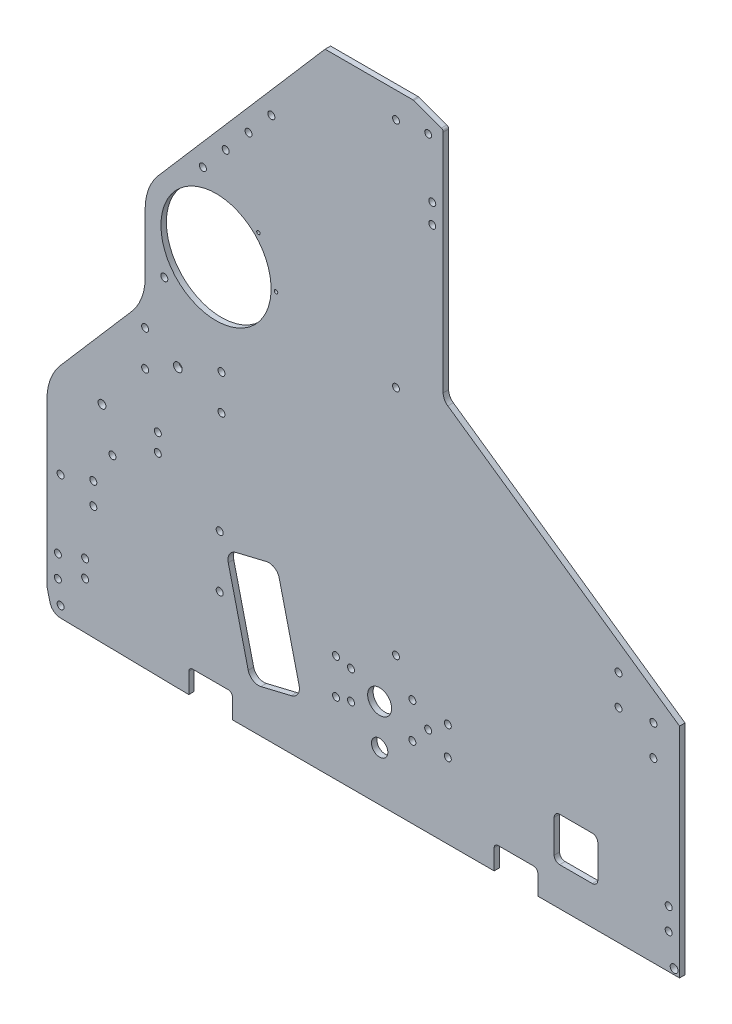
from build123d import *

# Parameters (mm, degrees)
SKETCH1_R           = 2.032
SKETCH1_R_2         = 2.54
SKETCH1_R_3         = 2
BOSS_EXTRUDE1_DEPTH = 3.175
FILLET1_R           = 2.286
FILLET2_R           = 6.35
SKETCH2_R           = 2.032
CUT_EXTRUDE1_DEPTH  = 505.524983177
FILLET3_R           = 1.5875
SKETCH3_R           = 2.032
SKETCH3_R_2         = 2.286
SKETCH3_R_3         = 1.016
CUT_EXTRUDE2_DEPTH  = 505.524983177
SKETCH4_R           = 2.032
SKETCH4_R_2         = 6.985
SKETCH4_R_3         = 4.7625
CUT_EXTRUDE3_DEPTH  = 505.524983177
SKETCH5_R           = 32.0675
SKETCH5_R_2         = 2.286
CUT_EXTRUDE5_DEPTH  = 540.282512071
FILLET4_R           = 31.75
CUT_EXTRUDE6_DEPTH  = 505.524983177


with BuildPart() as part:
    # Sketch1 → Boss-Extrude1 (new body)
    with BuildSketch(Plane.XY):
        with BuildLine():
            Line((7.829508682, -19.049081656), (82.55, -20.32))
            Line((82.55, -20.32), (82.55, -6.35))
            Line((82.55, -6.35), (107.95, -6.35))
            Line((107.95, -6.35), (107.95, -20.32))
            Line((107.95, -20.32), (260.35, -20.32))
            Line((260.35, -20.32), (260.35, -6.35))
            Line((260.35, -6.35), (285.75, -6.35))
            Line((285.75, -6.35), (285.75, -20.32))
            Line((285.75, -20.32), (368.3, -20.32))
            Line((368.3, -20.32), (368.3, 106.68))
            Line((368.3, 106.68), (230.66375, 202.565))
            Line((230.66375, 202.565), (230.66375, 338.455))
            Line((230.66375, 338.455), (213.19998, 344.805))
            Line((213.19998, 344.805), (203.2, 344.805))
            Line((203.2, 344.805), (161.925, 344.805))
            Line((161.925, 344.805), (52.720122664, 218.469945827))
            ThreePointArc((52.720122664, 218.469945827), (52.803835479, 218.142145922), (52.832, 217.805))
            ThreePointArc((52.832, 217.805), (52.095493096, 216.239521914), (50.419872403, 215.808871996))
            Line((50.419872403, 215.808871996), (0, 157.48))
            Line((0, 157.48), (0, 0))
            Line((0, 0), (0, -6.35))
            ThreePointArc((0, -6.35), (0.047577015, -7.125863724), (0.189595124, -7.890101219))
            Line((0.189595124, -7.890101219), (1.777095124, -14.240101219))
            ThreePointArc((1.777095124, -14.240101219), (3.987212552, -17.671692778), (7.829508682, -19.049081656))
        make_face()
        with Locations((7.9375, -12.7)):
            Circle(SKETCH1_R, mode=Mode.SUBTRACT)
        with Locations((6.35, 0)):
            Circle(SKETCH1_R, mode=Mode.SUBTRACT)
        with Locations((6.35, 12.7)):
            Circle(SKETCH1_R, mode=Mode.SUBTRACT)
        with Locations((38.1, 78.105)):
            Circle(SKETCH1_R, mode=Mode.SUBTRACT)
        with Locations((57.15, 131.28625)):
            Circle(SKETCH1_R, mode=Mode.SUBTRACT)
        with Locations((57.15, 151.92375)):
            Circle(SKETCH1_R, mode=Mode.SUBTRACT)
        with Locations((76.2, 141.605)):
            Circle(SKETCH1_R_2, mode=Mode.SUBTRACT)
        with Locations((101.6, 131.28625)):
            Circle(SKETCH1_R, mode=Mode.SUBTRACT)
        with Locations((101.6, 151.92375)):
            Circle(SKETCH1_R, mode=Mode.SUBTRACT)
        with Locations((203.2, 59.805)):
            Circle(SKETCH1_R_3, mode=Mode.SUBTRACT)
        with Locations((361.95, 0)):
            Circle(SKETCH1_R, mode=Mode.SUBTRACT)
        with Locations((361.95, 12.7)):
            Circle(SKETCH1_R, mode=Mode.SUBTRACT)
        with Locations((353.06, 82.955052336)):
            Circle(SKETCH1_R, mode=Mode.SUBTRACT)
        with Locations((332.74, 98.195052336)):
            Circle(SKETCH1_R, mode=Mode.SUBTRACT)
        with Locations((332.74, 115.975052336)):
            Circle(SKETCH1_R, mode=Mode.SUBTRACT)
        with Locations((353.06, 100.735052336)):
            Circle(SKETCH1_R, mode=Mode.SUBTRACT)
        with Locations((68.326, 182.923674932)):
            Circle(SKETCH1_R, mode=Mode.SUBTRACT)
        with Locations((76.2, 217.805)):
            Circle(SKETCH1_R, mode=Mode.SUBTRACT)
        with Locations((90.779500502, 249.682)):
            Circle(SKETCH1_R, mode=Mode.SUBTRACT)
        with Locations((104.067838673, 265.054783374)):
            Circle(SKETCH1_R, mode=Mode.SUBTRACT)
        with Locations((117.356176844, 280.427566748)):
            Circle(SKETCH1_R, mode=Mode.SUBTRACT)
        with Locations((130.644515014, 295.800350122)):
            Circle(SKETCH1_R, mode=Mode.SUBTRACT)
        with Locations((203.2, 194.805)):
            Circle(SKETCH1_R_3, mode=Mode.SUBTRACT)
        with Locations((224.31375, 287.401)):
            Circle(SKETCH1_R, mode=Mode.SUBTRACT)
        with Locations((224.31375, 298.831)):
            Circle(SKETCH1_R, mode=Mode.SUBTRACT)
        with Locations((203.2, 329.805)):
            Circle(SKETCH1_R_3, mode=Mode.SUBTRACT)
        with Locations((221.931865, 332.105)):
            Circle(SKETCH1_R_3, mode=Mode.SUBTRACT)
    extrude(amount=BOSS_EXTRUDE1_DEPTH)

    # Fillet1
    fillet1_edges = [part.edges().sort_by_distance(p)[0] for p in [
        (285.75, -6.35, 1.5875),
        (107.95, -6.35, 1.5875),
        (260.35, -6.35, 1.5875),
        (82.55, -6.35, 1.5875),
    ]]
    fillet(fillet1_edges, radius=FILLET1_R)

    # Fillet2
    fillet2_edges = [part.edges().sort_by_distance(p)[0] for p in [
        (230.66375, 202.565, 1.5875),
    ]]
    fillet(fillet2_edges, radius=FILLET2_R)

    # Sketch2 → Cut-Extrude1 (cut, through all)
    with BuildSketch(Plane(origin=(0, 0, 0), x_dir=(-1, 0, 0), z_dir=(0, 0, -1))):
        with Locations((-100.552770272, 71.086035298)):
            Circle(SKETCH2_R)
        with Locations((-100.552770272, 40.606035298)):
            Circle(SKETCH2_R)
        with Locations((-22.225, 18.202541089)):
            Circle(SKETCH2_R)
        with Locations((-22.225, 8.042541089)):
            Circle(SKETCH2_R)
    extrude(amount=-CUT_EXTRUDE1_DEPTH, mode=Mode.SUBTRACT)

    # Fillet3
    fillet3_edges = [part.edges().sort_by_distance(p)[0] for p in [
        (230.66375, 338.455, 1.5875),
        (213.19998, 344.805, 1.5875),
    ]]
    fillet(fillet3_edges, radius=FILLET3_R)

    # Sketch3 → Cut-Extrude2 (cut, through all)
    with BuildSketch(Plane.XY.offset(3.175)):
        with BuildLine():
            Line((127.789357836, 69.359781229), (110.090757964, 65.117192092))
            ThreePointArc((110.090757964, 65.117192092), (106.28794748, 62.356296076), (105.551202695, 57.715054701))
            Line((105.551202695, 57.715054701), (117.160045499, 9.28701769))
            ThreePointArc((117.160045499, 9.28701769), (119.920941515, 5.484207206), (124.56218289, 4.74746242))
            Line((124.56218289, 4.74746242), (142.260782762, 8.990051558))
            ThreePointArc((142.260782762, 8.990051558), (146.063593246, 11.750947574), (146.800338031, 16.392188949))
            Line((146.800338031, 16.392188949), (135.191495227, 64.82022596))
            ThreePointArc((135.191495227, 64.82022596), (132.430599211, 68.623036444), (127.789357836, 69.359781229))
        make_face()
        with Locations((26.987500002, 46.953113935)):
            Circle(SKETCH3_R)
        with Locations((26.987500002, 59.653113935)):
            Circle(SKETCH3_R)
        with Locations((7.937500002, 53.303113935)):
            Circle(SKETCH3_R)
        with Locations((32.03059934, 100.810872615)):
            Circle(SKETCH3_R_2)
        with Locations((64.525942114, 102.94048958)):
            Circle(SKETCH3_R)
        with Locations((64.525942114, 92.525786339)):
            Circle(SKETCH3_R)
        with Locations((133.35, 208.228121768)):
            Circle(SKETCH3_R_3)
        with Locations((123.120704333, 232.923826101)):
            Circle(SKETCH3_R_3)
    extrude(amount=-CUT_EXTRUDE2_DEPTH, mode=Mode.SUBTRACT)

    # Sketch4 → Cut-Extrude3 (cut, through all)
    with BuildSketch(Plane.XY.offset(3.175)):
        with Locations((168.275, 42.06875)):
            Circle(SKETCH4_R)
        with Locations((212.725, 42.06875)):
            Circle(SKETCH4_R)
        with Locations((212.725, 21.43125)):
            Circle(SKETCH4_R)
        with Locations((168.275, 21.43125)):
            Circle(SKETCH4_R)
        with Locations((193.675, 31.75)):
            Circle(SKETCH4_R_2)
        with Locations((177.00498, 40.0431)):
            Circle(SKETCH4_R)
        with Locations((177.00498, 23.4569)):
            Circle(SKETCH4_R)
        with Locations((193.675, 8.466666658)):
            Circle(SKETCH4_R_3)
        with Locations((221.931865, 31.75)):
            Circle(SKETCH4_R)
        with Locations((233.36123, 23.4569)):
            Circle(SKETCH4_R)
        with Locations((233.36123, 40.0431)):
            Circle(SKETCH4_R)
    extrude(amount=-CUT_EXTRUDE3_DEPTH, mode=Mode.SUBTRACT)

    # Sketch5 → Cut-Extrude5 (cut, through all)
    with BuildSketch(Plane(origin=(0, 0, -187.324999476), x_dir=(-1, 0, 0), z_dir=(0, 0, -1))):
        Polygon((0, 157.48), (-57.15, 223.594705882), (-57.15, 165.333696112), (0, 99.218990229), align=None)
        with Locations((-98.425, 208.228121768)):
            Circle(SKETCH5_R)
        with Locations((-365.124999998, -17.144978643)):
            Circle(SKETCH5_R_2)
    extrude(amount=-CUT_EXTRUDE5_DEPTH, mode=Mode.SUBTRACT)

    # Fillet4
    fillet4_edges = [part.edges().sort_by_distance(p)[0] for p in [
        (0, 99.218990229, 1.5875),
        (57.15, 165.333696112, 1.5875),
        (57.15, 223.594705882, 1.5875),
    ]]
    fillet(fillet4_edges, radius=FILLET4_R)

    # Sketch6 → Cut-Extrude6 (cut, through all)
    with BuildSketch(Plane.XY.offset(3.175)):
        with BuildLine():
            Line((298.45, 27.305), (317.5, 27.305))
            ThreePointArc((317.5, 27.305), (319.74506403, 26.37506403), (320.675, 24.13))
            Line((320.675, 24.13), (320.675, 5.08))
            ThreePointArc((320.675, 5.08), (319.74506403, 2.83493597), (317.5, 1.905))
            Line((317.5, 1.905), (298.45, 1.905))
            ThreePointArc((298.45, 1.905), (296.20493597, 2.83493597), (295.275, 5.08))
            Line((295.275, 5.08), (295.275, 24.13))
            ThreePointArc((295.275, 24.13), (296.20493597, 26.37506403), (298.45, 27.305))
        make_face()
    extrude(amount=-CUT_EXTRUDE6_DEPTH, mode=Mode.SUBTRACT)


solid = part.part
